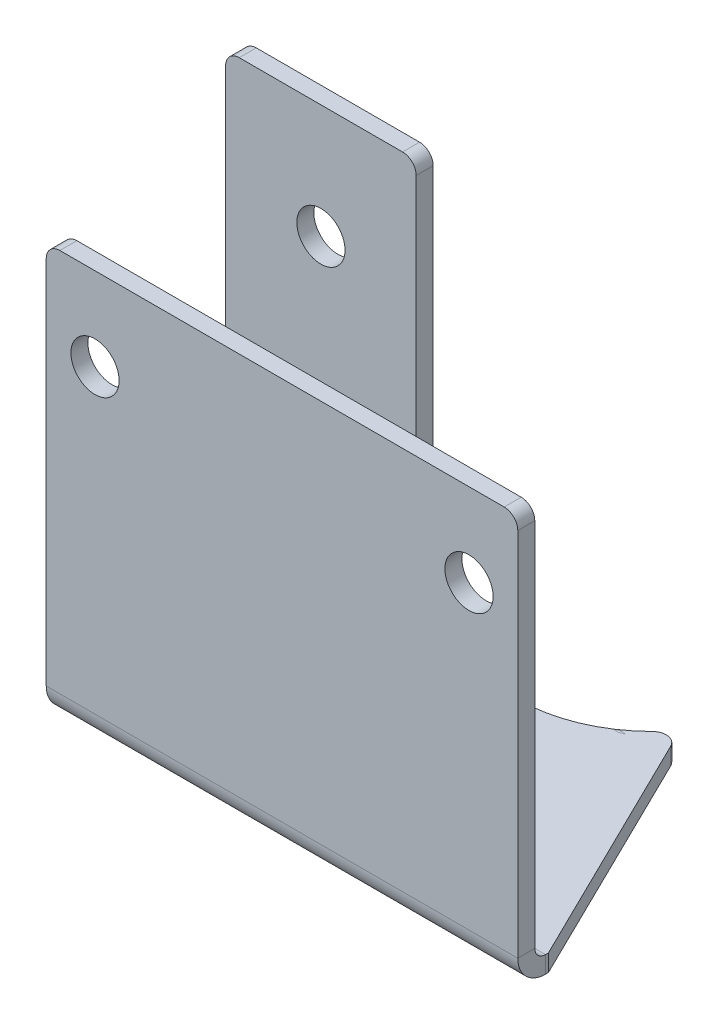
from build123d import *

# Parameters (mm, degrees)
BASE_FLANGE1_DEPTH            = 1.5875
EDGE_FLANGE1_DEPTH            = 17.78
M4_CLEARANCE_HOLE1_D          = 4.5
FILLET1_R                     = 1.27
BASE_FLANGE2_DEPTH            = 1.5875
EDGE_FLANGE2_DEPTH            = 43.999999884
SKETCH21_W                    = 2.25
SKETCH21_H                    = 1.5875
M4_CLEARANCE_HOLE2_AT_2_COUNT = 2
M4_CLEARANCE_HOLE2_AT_2_PITCH = 34.9
FILLET2_R                     = 1.27


# Sheet-metal steps are written as plain solids
with BuildPart() as part:
    # Sketch1 → Base-Flange1 (new body)
    with BuildSketch(Plane(origin=(0, 0, 0), x_dir=(1, 0, 0), z_dir=(0, 1, 0))):
        with BuildLine():
            Line((-8.89, -9.069614104), (-8.89, -28.119614104))
            Line((-8.89, -28.119614104), (8.89, -28.119614104))
            Line((8.89, -28.119614104), (8.89, -9.069614104))
            ThreePointArc((8.89, -9.069614104), (0, -12.7), (-8.89, -9.069614104))
        make_face()
    extrude(amount=-BASE_FLANGE1_DEPTH)

    # Edge-Flange1 section (across the edge) → Edge-Flange1 (add)
    with BuildSketch(Plane(origin=(-8.89, 0, 29.389614104), x_dir=(0, 0, -1), z_dir=(1, 0, 0))):
        with BuildLine():
            Line((-1.5875, 1), (-1.5875, 57.15))
            Line((-1.5875, 57.15), (0, 57.15))
            Line((0, 57.15), (0, 1))
            ThreePointArc((0, 1), (0.292893219, 0.292893219), (1, 0))
            Line((1, 0), (1.27, 0))
            Line((1.27, 0), (1.27, -1.5875))
            Line((1.27, -1.5875), (1, -1.5875))
            ThreePointArc((1, -1.5875), (-0.829638796, -0.829638796), (-1.5875, 1))
        make_face()
    extrude(amount=EDGE_FLANGE1_DEPTH)

    # M4 Clearance Hole1 (through all)
    with Locations(Plane(origin=(0, 0, 29.389614104), x_dir=(-1, 0, 0), z_dir=(0, 0, -1))):
        with Locations((0, 46.524999898), (0, 11.625)):
            Hole(M4_CLEARANCE_HOLE1_D / 2)

    # Fillet1
    fillet1_edges = [part.edges().sort_by_distance(p)[0] for p in [
        (-8.89, 57.15, 30.183364104),
        (8.89, 57.15, 30.183364104),
        (8.89, -0.79375, 9.069614104),
        (-8.89, -0.79375, 9.069614104),
    ]]
    fillet(fillet1_edges, radius=FILLET1_R)


with BuildPart() as body_2:
    # Sketch12 → Base-Flange2 (new body)
    with BuildSketch(Plane(origin=(0, 0, 0), x_dir=(1, 0, 0), z_dir=(0, 1, 0))):
        with BuildLine():
            Line((-21.999999942, -31.75), (0, -31.75))
            Line((0, -31.75), (21.999999942, -31.75))
            Line((21.999999942, -31.75), (10.16, -7.62))
            ThreePointArc((10.16, -7.62), (0, -12.7), (-10.16, -7.62))
            Line((-10.16, -7.62), (-21.999999942, -31.75))
        make_face()
    extrude(amount=-BASE_FLANGE2_DEPTH)

    # Edge-Flange2 section (across the edge) → Edge-Flange2 (add)
    with BuildSketch(Plane(origin=(-21.999999942, 0, 33.02), x_dir=(0, 0, -1), z_dir=(1, 0, 0))):
        with BuildLine():
            Line((-1.5875, 1), (-1.5875, 36.83))
            Line((-1.5875, 36.83), (0, 36.83))
            Line((0, 36.83), (0, 1))
            ThreePointArc((0, 1), (0.292893219, 0.292893219), (1, 0))
            Line((1, 0), (1.27, 0))
            Line((1.27, 0), (1.27, -1.5875))
            Line((1.27, -1.5875), (1, -1.5875))
            ThreePointArc((1, -1.5875), (-0.829638796, -0.829638796), (-1.5875, 1))
        make_face()
    extrude(amount=EDGE_FLANGE2_DEPTH)

    # Sketch21 → M4 Clearance Hole2 (revolve, cut)
    with BuildSketch(Plane(origin=(17.45, 29.075, 33.02), x_dir=(0, 1, 0), z_dir=(1, 0, 0))):
        with Locations((1.125, 0.79375)):
            Rectangle(SKETCH21_W, SKETCH21_H)
    m4_clearance_hole2 = revolve(axis=Axis((17.45, 29.075, 26.67), (0, 0, 1)), mode=Mode.SUBTRACT)

    # M4 Clearance Hole2 at 2: M4 Clearance Hole2 ×2
    with Locations(*[(-i * M4_CLEARANCE_HOLE2_AT_2_PITCH, 0, 0) for i in range(1, M4_CLEARANCE_HOLE2_AT_2_COUNT)]):
        add(m4_clearance_hole2, mode=Mode.SUBTRACT)

    # Fillet2
    fillet2_edges = [body_2.edges().sort_by_distance(p)[0] for p in [
        (-21.999999942, 36.83, 33.81375),
        (21.999999942, 36.83, 33.81375),
        (-10.16, -0.79375, 7.62),
        (10.16, -0.79375, 7.62),
    ]]
    fillet(fillet2_edges, radius=FILLET2_R)


solid = Compound([part.part, body_2.part])
